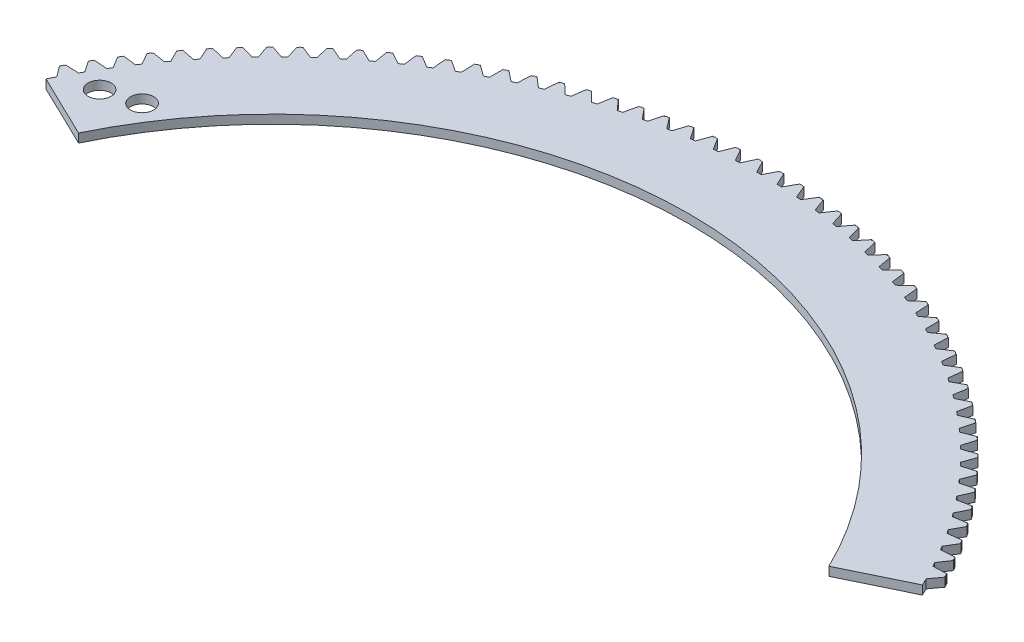
from build123d import *

# Parameters (mm, degrees)
SALIENTE_EXTRUIR1_DEPTH = 2.5
CROQUIS2_R              = 3.3
CORTAR_EXTRUIR1_DEPTH   = 2.5


# Read off the part's stored shape, not the designer's step: Saliente-Extruir1
with BuildPart() as part:
    # Saliente-Extruir1 outline → Saliente-Extruir1 (new body)
    with BuildSketch(Plane(origin=(0, 0, 0), x_dir=(1, 0, 0), z_dir=(0, 1, 0))):
        with BuildLine():
            Line((231.241720971, 10.756587138), (233.558294646, 13.910122691))
            Line((233.558294646, 13.910122691), (233.321502185, 13.98383382))
            ThreePointArc((233.321502185, 13.98383382), (233.28120566, 14.441592034), (232.928863632, 14.736586081))
            Line((232.928863632, 14.736586081), (233.002072992, 14.973534155))
            Line((233.002072992, 14.973534155), (229.092934922, 14.847916675))
            ThreePointArc((229.092934922, 14.847916675), (228.778691711, 15.41962652), (228.461768711, 15.989855207))
            Line((228.461768711, 15.989855207), (230.641815453, 19.2392427))
            Line((230.641815453, 19.2392427), (230.402096473, 19.302794338))
            ThreePointArc((230.402096473, 19.302794338), (230.342326111, 19.75841907), (229.9777311, 20.038127616))
            Line((229.9777311, 20.038127616), (230.040774792, 20.277980682))
            Line((230.040774792, 20.277980682), (226.140564472, 19.985864653))
            ThreePointArc((226.140564472, 19.985864653), (225.802234397, 20.543669629), (225.461290021, 21.099880526))
            Line((225.461290021, 21.099880526), (227.500850106, 24.439214589))
            Line((227.500850106, 24.439214589), (227.258640281, 24.492491234))
            ThreePointArc((227.258640281, 24.492491234), (227.17950471, 24.945154413), (226.803319347, 25.209069106))
            Line((226.803319347, 25.209069106), (226.856082792, 25.451391244))
            Line((226.856082792, 25.451391244), (222.971886977, 24.993309217))
            ThreePointArc((222.971886977, 24.993309217), (222.610084609, 25.536194527), (222.245738189, 26.077375734))
            Line((222.245738189, 26.077375734), (224.141107116, 29.500587723))
            Line((224.141107116, 29.500587723), (223.896846649, 29.543492548))
            ThreePointArc((223.896846649, 29.543492548), (223.798489693, 29.992371487), (223.411397671, 30.240012677))
            Line((223.411397671, 30.240012677), (223.453784976, 30.484363483))
            Line((223.453784976, 30.484363483), (219.592661225, 29.861149435))
            ThreePointArc((219.592661225, 29.861149435), (219.208043899, 30.388127406), (218.820957401, 30.913294344))
            Line((218.820957401, 30.913294344), (220.568692615, 34.414163365))
            Line((220.568692615, 34.414163365), (220.322825433, 34.446618393))
            ThreePointArc((220.322825433, 34.446618393), (220.205425851, 34.890897281), (219.808130686, 35.121814895))
            Line((219.808130686, 35.121814895), (219.840064814, 35.367750276))
            Line((219.840064814, 35.367750276), (216.009028683, 34.580538091))
            ThreePointArc((216.009028683, 34.580538091), (215.602295299, 35.090649975), (215.193172121, 35.598847186))
            Line((215.193172121, 35.598847186), (216.790099247, 39.171011388))
            Line((216.790099247, 39.171011388), (216.5430722, 39.192957634))
            ThreePointArc((216.5430722, 39.192957634), (216.406843358, 39.631829022), (216.00006711, 39.845603382))
            Line((216.00006711, 39.845603382), (216.021490023, 40.092676365))
            Line((216.021490023, 40.092676365), (212.227502332, 39.142897764))
            ThreePointArc((212.227502332, 39.142897764), (211.799392086, 39.63521549), (211.368975776, 40.125518384))
            Line((211.368975776, 40.125518384), (212.812194378, 43.762486511))
            Line((212.812194378, 43.762486511), (212.564456421, 43.773884089))
            ThreePointArc((212.564456421, 43.773884089), (212.409645907, 44.206550355), (211.994127867, 44.402792938))
            Line((211.994127867, 44.402792938), (212.00500063, 44.650554483))
            Line((212.00500063, 44.650554483), (208.254954832, 43.539936421))
            ThreePointArc((208.254954832, 43.539936421), (207.806245869, 44.013564291), (207.355318773, 44.485080831))
            Line((207.355318773, 44.485080831), (208.642207607, 48.180244006))
            Line((208.642207607, 48.180244006), (208.39420899, 48.181072202))
            ThreePointArc((208.39420899, 48.181072202), (208.221098162, 48.606747), (207.79759351, 48.785101149))
            Line((207.79759351, 48.785101149), (207.797896361, 49.033100964))
            Line((207.797896361, 49.033100964), (204.098606032, 47.763662489))
            ThreePointArc((204.098606032, 47.763662489), (203.630114028, 48.217738812), (203.159495862, 48.669611146))
            Line((203.159495862, 48.669611146), (204.287717633, 52.416254868))
            Line((204.287717633, 52.416254868), (204.039909078, 52.406512176))
            ThreePointArc((204.039909078, 52.406512176), (203.848812554, 52.824421869), (203.418090983, 52.984563434))
            Line((203.418090983, 52.984563434), (203.407823374, 53.232350795))
            Line((203.407823374, 53.232350795), (199.766009846, 51.806399377))
            ThreePointArc((199.766009846, 51.806399377), (199.278586525, 52.240098045), (198.789132884, 52.671504073))
            Line((198.789132884, 52.671504073), (199.756638476, 56.462820403))
            Line((199.756638476, 56.462820403), (199.50947036, 56.44252453))
            ThreePointArc((199.50947036, 56.44252453), (199.300735447, 56.851909592), (198.863579768, 56.993547527))
            Line((198.863579768, 56.993547527), (198.842760358, 57.240672095))
            Line((198.842760358, 57.240672095), (195.265040529, 55.660799433))
            ThreePointArc((195.265040529, 55.660799433), (194.759572106, 56.073331429), (194.252172902, 56.483486305))
            Line((194.252172902, 56.483486305), (195.057205098, 60.312586224))
            Line((195.057205098, 60.312586224), (194.811126634, 60.281774058))
            ThreePointArc((194.811126634, 60.281774058), (194.585132695, 60.681890456), (194.142337411, 60.804767342))
            Line((194.142337411, 60.804767342), (194.111004039, 61.050779984))
            Line((194.111004039, 61.050779984), (190.603878359, 59.3198573))
            ThreePointArc((190.603878359, 59.3198573), (190.081283927, 59.710472139), (189.55686177, 60.098629702))
            Line((189.55686177, 60.098629702), (190.197958433, 63.958555616))
            Line((190.197958433, 63.958555616), (189.953416854, 63.917283155))
            ThreePointArc((189.953416854, 63.917283155), (189.710574619, 64.307403703), (189.262944484, 64.411296219))
            Line((189.262944484, 64.411296219), (189.221154097, 64.65574982))
            Line((189.221154097, 64.65574982), (185.790994777, 62.776922647))
            ThreePointArc((185.790994777, 62.776922647), (185.252224631, 63.144909747), (184.711733143, 63.510363885))
            Line((184.711733143, 63.510363885), (185.187729868, 67.394102252))
            Line((185.187729868, 67.394102252), (184.945169613, 67.342444505))
            ThreePointArc((184.945169613, 67.342444505), (184.685920434, 67.721860182), (184.234268988, 67.806579509))
            Line((184.234268988, 67.806579509), (184.182097536, 68.049029792))
            Line((184.182097536, 68.049029792), (180.835136985, 66.025712256))
            ThreePointArc((180.835136985, 66.025712256), (180.281170888, 66.370402237), (179.725592965, 66.712488179))
            Line((179.725592965, 66.712488179), (180.035625189, 70.612982232))
            Line((180.035625189, 70.612982232), (179.795487097, 70.551033086))
            ThreePointArc((179.795487097, 70.551033086), (179.520302142, 70.919054326), (179.065450235, 70.984446493))
            Line((179.065450235, 70.984446493), (179.002992537, 71.224452818))
            Line((179.002992537, 71.224452818), (175.745312048, 69.060321447))
            ThreePointArc((175.745312048, 69.060321447), (175.177157442, 69.381087351), (174.607503463, 69.699182878))
            Line((174.607503463, 69.699182878), (174.751008032, 73.609345439))
            Line((174.751008032, 73.609345439), (174.513728539, 73.537217481))
            ThreePointArc((174.513728539, 73.537217481), (174.223107942, 73.89317543), (173.76588224, 73.939121589))
            Line((173.76588224, 73.939121589), (173.693251809, 74.176247759))
            Line((173.693251809, 74.176247759), (170.530770528, 71.875234809))
            ThreePointArc((170.530770528, 71.875234809), (169.9494607, 72.171493245), (169.366766678, 72.465019826))
            Line((169.366766678, 72.465019826), (169.34348287, 76.377746164))
            Line((169.34348287, 76.377746164), (169.109493217, 76.295570484))
            ThreePointArc((169.109493217, 76.295570484), (168.803965162, 76.638818208), (168.345196644, 76.665234856))
            Line((168.345196644, 76.665234856), (168.262525481, 76.899049908))
            Line((168.262525481, 76.899049908), (165.200989666, 74.465336225))
            ThreePointArc((165.200989666, 74.465336225), (164.607581858, 74.736548435), (164.012907555, 75.004972283))
            Line((164.012907555, 75.004972283), (163.82287755, 78.913153007))
            Line((163.82287755, 78.913153007), (163.592603, 78.821078953))
            ThreePointArc((163.592603, 78.821078953), (163.272722766, 79.150992621), (162.813245216, 79.157831747))
            Line((162.813245216, 79.157831747), (162.720683571, 79.387910738))
            Line((162.720683571, 79.387910738), (159.765656159, 76.82591817))
            ThreePointArc((159.765656159, 76.82591817), (159.161229642, 77.071591011), (158.555656633, 77.314424059))
            Line((158.555656633, 77.314424059), (158.199225438, 81.21095802))
            Line((158.199225438, 81.21095802), (157.9730845, 81.109152931))
            ThreePointArc((157.9730845, 81.109152931), (157.63943345, 81.425132945), (157.18008194, 81.412382119))
            Line((157.18008194, 81.412382119), (157.07779804, 81.638306894))
            Line((157.07779804, 81.638306894), (154.234648555, 78.952690272))
            ThreePointArc((154.234648555, 78.952690272), (153.620302657, 79.172377115), (153.004932353, 79.389177902))
            Line((153.004932353, 79.389177902), (152.48274718, 83.266985082))
            Line((152.48274718, 83.266985082), (152.261150852, 83.155633983))
            ThreePointArc((152.261150852, 83.155633983), (151.914335376, 83.457106069), (151.455944751, 83.424788465))
            Line((151.455944751, 83.424788465), (151.344124488, 83.646148418))
            Line((151.344124488, 83.646148418), (148.618019294, 80.841787107))
            ThreePointArc((148.618019294, 80.841787107), (147.994871393, 81.035088651), (147.370823037, 81.225463131))
            Line((147.370823037, 81.225463131), (146.683832128, 85.077497489))
            Line((146.683832128, 85.077497489), (146.467183147, 84.956802754))
            ThreePointArc((146.467183147, 84.956802754), (146.107833561, 85.243219003), (145.651236918, 85.191393356))
            Line((145.651236918, 85.191393356), (145.53008352, 85.40778618))
            Line((145.53008352, 85.40778618), (142.925976442, 82.489775226))
            ThreePointArc((142.925976442, 82.489775226), (142.29515993, 82.656340227), (141.663568549, 82.819942483))
            Line((141.663568549, 82.819942483), (140.813019458, 86.639204743))
            Line((140.813019458, 86.639204743), (140.601711571, 86.509385727))
            ThreePointArc((140.601711571, 86.509385727), (140.230480972, 86.780225597), (139.776508146, 86.708986097))
            Line((139.776508146, 86.708986097), (139.646241802, 86.920018511))
            Line((139.646241802, 86.920018511), (137.168865135, 83.893659398))
            ThreePointArc((137.168865135, 83.893659398), (136.531527347, 84.033185307), (135.893541681, 84.169718182))
            Line((135.893541681, 84.169718182), (134.880979016, 87.949268538))
            Line((134.880979016, 87.949268538), (134.675396262, 87.810561179))
            ThreePointArc((134.675396262, 87.810561179), (134.292959339, 88.065332434), (133.842435399, 87.974808555))
            Line((133.842435399, 87.974808555), (133.70329286, 88.18009702))
            Line((133.70329286, 88.18009702), (131.357148774, 85.050888051))
            ThreePointArc((131.357148774, 85.050888051), (130.714448893, 85.163121563), (130.071229302, 85.272337201))
            Line((130.071229302, 85.272337201), (128.898491924, 89.005307911))
            Line((128.898491924, 89.005307911), (128.699007938, 88.857964302))
            ThreePointArc((128.699007938, 88.857964302), (128.306059746, 89.09620391), (127.859803492, 88.986560174))
            Line((127.859803492, 88.986560174), (127.712037641, 89.185731591))
            Line((127.712037641, 89.185731591), (125.501390012, 85.959357913))
            ThreePointArc((125.501390012, 85.959357913), (124.854496956, 86.04409543), (124.207213298, 86.125795724))
            Line((124.207213298, 86.125795724), (122.876430991, 89.805403576))
            Line((122.876430991, 89.805403576), (122.683408322, 89.649691504))
            ThreePointArc((122.683408322, 89.649691504), (122.280663021, 89.87096648), (121.839485497, 89.742402157))
            Line((121.839485497, 89.742402157), (121.683364889, 89.935094544))
            Line((121.683364889, 89.935094544), (119.61223155, 86.617417836))
            ThreePointArc((119.61223155, 86.617417836), (118.962321838, 86.674505831), (118.312151336, 86.728542782))
            Line((118.312151336, 86.728542782), (116.825740946, 90.348101406))
            Line((116.825740946, 90.348101406), (116.639530401, 90.184303869))
            ThreePointArc((116.639530401, 90.184303869), (116.227719956, 90.388212059), (115.792422975, 90.240960807))
            Line((115.792422975, 90.240960807), (115.628231351, 90.426823957))
            Line((115.628231351, 90.426823957), (113.700376796, 87.023871791))
            ThreePointArc((113.700376796, 87.023871791), (113.048632398, 87.05320709), (112.396757493, 87.079483076))
            Line((112.396757493, 87.079483076), (110.757418551, 90.632415082))
            Line((110.757418551, 90.632415082), (110.578358557, 90.460829772))
            ThreePointArc((110.578358557, 90.460829772), (110.158231408, 90.647000585), (109.729606096, 90.481330024))
            Line((109.729606096, 90.481330024), (109.557641864, 90.660026143))
            Line((109.557641864, 90.660026143), (107.776570409, 87.177981051))
            ThreePointArc((107.776570409, 87.177981051), (107.124176596, 87.179511014), (106.471782788, 87.177978961))
            Line((106.471782788, 87.177978961), (104.682492614, 90.657827881))
            Line((104.682492614, 90.657827881), (104.510908601, 90.478766644))
            ThreePointArc((104.510908601, 90.478766644), (104.083228304, 90.646861725), (103.662053662, 90.463072952))
            Line((103.662053662, 90.463072952), (103.482629355, 90.634277269))
            Line((103.482629355, 90.634277269), (101.851578772, 87.079465527))
            ThreePointArc((101.851578772, 87.079465527), (101.199721948, 87.05318814), (100.547995635, 87.023851608))
            Line((100.547995635, 87.023851608), (98.612003943, 90.424293616))
            Line((98.612003943, 90.424293616), (98.448207755, 90.238081884))
            ThreePointArc((98.448207755, 90.238081884), (98.013751593, 90.387795732), (97.600793079, 90.186222771))
            Line((97.600793079, 90.186222771), (97.414234792, 90.349624134))
            Line((97.414234792, 90.349624134), (95.936170422, 86.72850428))
            ThreePointArc((95.936170422, 86.72850428), (95.286035963, 86.674468156), (94.636162274, 86.617381326))
            Line((94.636162274, 86.617381326), (92.556985283, 89.932236722))
            Line((92.556985283, 89.932236722), (92.40127461, 89.739212924))
            ThreePointArc((92.40127461, 89.739212924), (91.960832181, 89.870273442), (91.556840323, 89.651282641))
            Line((91.556840323, 89.651282641), (91.363487113, 89.806584077))
            Line((91.363487113, 89.806584077), (90.041096475, 86.125735193))
            ThreePointArc((90.041096475, 86.125735193), (89.393866565, 86.044039481), (88.747027203, 85.959307049))
            Line((88.747027203, 85.959307049), (86.528441263, 89.182551482))
            Line((86.528441263, 89.182551482), (86.381099099, 88.983066428))
            ThreePointArc((86.381099099, 88.983066428), (85.93547088, 89.095235422), (85.541179909, 88.859224782))
            Line((85.541179909, 88.859224782), (85.341383184, 89.006144041))
            Line((85.341383184, 89.006144041), (84.177071088, 85.272253815))
            ThreePointArc((84.177071088, 85.272253815), (83.533922567, 85.163048012), (82.891293651, 85.050824997))
            Line((82.891293651, 85.050824997), (80.537328396, 88.176600404))
            Line((80.537328396, 88.176600404), (80.398622527, 87.971016645))
            ThreePointArc((80.398622527, 87.971016645), (79.94861842, 88.064090255), (79.564744935, 87.811488711))
            Line((79.564744935, 87.811488711), (79.358867813, 87.949758776))
            Line((79.358867813, 87.949758776), (78.354751985, 84.169611368))
            ThreePointArc((78.354751985, 84.169611368), (77.716854199, 84.033095038), (77.079604123, 83.893586496))
            Line((77.079604123, 83.893586496), (74.594535166, 86.916211742))
            Line((74.594535166, 86.916211742), (74.464717681, 86.704902915))
            ThreePointArc((74.464717681, 86.704902915), (74.011155542, 86.778711985), (73.63839721, 86.509978626))
            Line((73.63839721, 86.509978626), (73.42681386, 86.639348198))
            Line((73.42681386, 86.639348198), (72.584721081, 82.819811926))
            ThreePointArc((72.584721081, 82.819811926), (71.953233757, 82.656234337), (71.322521057, 82.489694975))
            Line((71.322521057, 82.489694975), (68.710862238, 85.403676178))
            Line((68.710862238, 85.403676178), (68.590169073, 85.187026322))
            ThreePointArc((68.590169073, 85.187026322), (68.133873223, 85.241436709), (67.772907509, 84.957059941))
            Line((67.772907509, 84.957059941), (67.556002472, 85.0772939))
            Line((67.556002472, 85.0772939), (66.877465256, 81.225308774))
            ThreePointArc((66.877465256, 81.225308774), (66.253536383, 81.034968433), (65.630507631, 80.841702145))
            Line((65.630507631, 80.841702145), (62.897002831, 83.641742651))
            Line((62.897002831, 83.641742651), (62.785653338, 83.420145516))
            ThreePointArc((62.785653338, 83.420145516), (62.327453067, 83.455058331), (61.978936005, 83.155554992))
            Line((61.978936005, 83.155554992), (61.757103493, 83.26643482))
            Line((61.757103493, 83.26643482), (61.243357289, 79.388999945))
            ThreePointArc((61.243357289, 79.388999945), (60.62812103, 79.172244052), (60.01390874, 78.952603357))
            Line((60.01390874, 78.952603357), (57.163523282, 81.63361337))
            Line((57.163523282, 81.63361337), (57.061719831, 81.407471695))
            ThreePointArc((57.061719831, 81.407471695), (56.602447891, 81.422823486), (56.26701289, 81.108737905))
            Line((56.26701289, 81.108737905), (56.040656068, 81.210062085))
            Line((56.040656068, 81.210062085), (55.692637004, 77.314222959))
            ThreePointArc((55.692637004, 77.314222959), (55.08721163, 77.071446764), (54.482932201, 76.825832157))
            Line((54.482932201, 76.825832157), (51.52084384, 79.382937988))
            Line((51.52084384, 79.382937988), (51.428771454, 79.15266277))
            ThreePointArc((51.428771454, 79.15266277), (50.969262543, 79.148425638), (50.647519235, 78.820328646))
            Line((50.647519235, 78.820328646), (50.417049495, 78.911913027))
            Line((50.417049495, 78.911913027), (50.235392664, 75.004748748))
            ThreePointArc((50.235392664, 75.004748748), (49.64087852, 74.736394829), (49.0476302, 74.465254046))
            Line((49.0476302, 74.465254046), (45.979219734, 76.893806969))
            Line((45.979219734, 76.893806969), (45.897045749, 76.659816721))
            ThreePointArc((45.897045749, 76.659816721), (45.438134997, 76.635998366), (45.130668131, 76.294486259))
            Line((45.130668131, 76.294486259), (44.896504337, 76.376164392))
            Line((44.896504337, 76.376164392), (44.88154263, 72.464774806))
            ThreePointArc((44.88154263, 72.464774806), (44.299020128, 72.171332254), (43.717881017, 71.875159449))
            Line((43.717881017, 71.875159449), (40.54872253, 74.17074416))
            Line((40.54872253, 74.17074416), (40.476596291, 73.933464144))
            ThreePointArc((40.476596291, 73.933464144), (40.01911774, 73.890107854), (39.726486119, 73.535801311))
            Line((39.726486119, 73.535801311), (39.489053849, 73.60742475))
            Line((39.489053849, 73.60742475), (39.640817335, 69.698917562))
            ThreePointArc((39.640817335, 69.698917562), (39.071344994, 69.380921081), (38.503371082, 69.06025592))
            Line((38.503371082, 69.06025592), (35.239221825, 71.21869856))
            Line((35.239221825, 71.21869856), (35.177274418, 70.97856002))
            ThreePointArc((35.177274418, 70.97856002), (34.722059508, 70.915744592), (34.444794971, 70.549287542))
            Line((34.444794971, 70.549287542), (34.204525744, 70.610726118))
            Line((34.204525744, 70.610726118), (34.5227416, 66.712203981))
            ThreePointArc((34.5227416, 66.712203981), (33.967354116, 66.370232912), (33.413577365, 66.025659583))
            Line((33.413577365, 66.025659583), (30.060367315, 68.043035335))
            Line((30.060367315, 68.043035335), (30.008711326, 67.800474706))
            ThreePointArc((30.008711326, 67.800474706), (29.556587382, 67.718314304), (29.295193842, 67.340372761))
            Line((29.295193842, 67.340372761), (29.052524332, 67.391514812))
            Line((29.052524332, 67.391514812), (29.53661732, 63.510062432))
            ThreePointArc((29.53661732, 63.510062432), (28.996323689, 63.144739689), (28.457750154, 62.776885831))
            Line((28.457750154, 62.776885831), (25.021571254, 64.649526058))
            Line((25.021571254, 64.649526058), (24.980300564, 64.40498418))
            ThreePointArc((24.980300564, 64.40498418), (24.532089294, 64.303628126), (24.287041817, 63.914888976))
            Line((24.287041817, 63.914888976), (24.042413062, 63.955641553))
            Line((24.042413062, 63.955641553), (24.69150656, 60.09831282))
            ThreePointArc((24.69150656, 60.09831282), (24.167288243, 59.71030375), (23.644896244, 59.319839305))
            Line((23.644896244, 59.319839305), (20.131991348, 61.044338227))
            Line((20.131991348, 61.044338227), (20.101180964, 60.79825954))
            ThreePointArc((20.101180964, 60.79825954), (19.657696964, 60.677892042), (19.429440909, 60.279061795))
            Line((19.429440909, 60.279061795), (19.183297508, 60.309350834))
            Line((19.183297508, 60.309350834), (19.996215084, 56.483156006))
            ThreePointArc((19.996215084, 56.483156006), (19.489024223, 56.073167169), (18.983762572, 55.660803156))
            Line((18.983762572, 55.660803156), (15.40051411, 57.234024053))
            Line((15.40051411, 57.234024053), (15.380220029, 56.98685579))
            ThreePointArc((15.380220029, 56.98685579), (14.942269305, 56.847695608), (14.731219514, 56.439499113))
            Line((14.731219514, 56.439499113), (14.484008816, 56.459269566))
            Line((14.484008816, 56.459269566), (15.459276348, 52.671162536))
            ThreePointArc((15.459276348, 52.671162536), (14.97003404, 52.239940415), (14.482820314, 51.806427626))
            Line((14.482820314, 51.806427626), (10.835738715, 53.225508549))
            Line((10.835738715, 53.225508549), (10.825997819, 52.977699923))
            ThreePointArc((10.825997819, 52.977699923), (10.39437632, 52.819999973), (10.200916362, 52.403179103))
            Line((10.200916362, 52.403179103), (9.953087658, 52.412395038))
            Line((9.953087658, 52.412395038), (11.088935996, 48.669260699))
            ThreePointArc((11.088935996, 48.669260699), (10.618530619, 48.217590333), (10.150249496, 47.763717962))
            Line((10.150249496, 47.763717962), (6.445961364, 49.026076949))
            Line((6.445961364, 49.026076949), (6.446791357, 48.778078338))
            ThreePointArc((6.446791357, 48.778078338), (6.022283528, 48.602125229), (5.846765006, 48.177437531))
            Line((5.846765006, 48.177437531), (5.59876871, 48.176082198))
            Line((5.59876871, 48.176082198), (6.893136868, 44.484723931))
            ThreePointArc((6.893136868, 44.484723931), (6.44242247, 44.013427481), (5.993924127, 43.540021684))
            Line((5.993924127, 43.540021684), (2.239160211, 44.643361465))
            Line((2.239160211, 44.643361465), (2.250559584, 44.395623591))
            ThreePointArc((2.250559584, 44.395623591), (1.833936943, 44.201737108), (1.676678851, 43.769954425))
            Line((1.676678851, 43.769954425), (1.42896568, 43.758030288))
            Line((1.42896568, 43.758030288), (2.879504567, 40.1251576))
            ThreePointArc((2.879504567, 40.1251576), (2.44929932, 39.635092846), (2.021397889, 39.143015226))
            Line((2.021397889, 39.143015226), (-1.777019139, 40.085327417))
            Line((-1.777019139, 40.085327417), (-1.755071104, 39.838300528))
            ThreePointArc((-1.755071104, 39.838300528), (-2.16305137, 39.626833048), (-2.301763225, 39.18874012))
            Line((-2.301763225, 39.18874012), (-2.548743067, 39.166268849))
            Line((-2.548743067, 39.166268849), (-0.944666399, 35.598485174))
            ThreePointArc((-0.944666399, 35.598485174), (-1.353581684, 35.090543949), (-1.760109589, 34.580689988))
            Line((-1.760109589, 34.580689988), (-5.595277524, 35.360258754))
            Line((-5.595277524, 35.360258754), (-5.562820714, 35.114391807))
            ThreePointArc((-5.562820714, 35.114391807), (-5.961417127, 34.885727659), (-6.081330645, 34.442120693))
            Line((-6.081330645, 34.442120693), (-6.327128286, 34.409143129))
            Line((-6.327128286, 34.409143129), (-4.572425876, 30.912933825))
            ThreePointArc((-4.572425876, 30.912933825), (-4.959309162, 30.388040387), (-5.343725854, 29.86133781))
            Line((-5.343725854, 29.86133781), (-9.208675489, 30.476743002))
            Line((-9.208675489, 30.476743002), (-9.165768895, 30.232482846))
            ThreePointArc((-9.165768895, 30.232482846), (-9.554257029, 29.987037613), (-9.655154275, 29.538722837))
            Line((-9.655154275, 29.538722837), (-9.899322993, 29.495298916))
            Line((-9.899322993, 29.495298916), (-7.997180694, 26.077019473))
            ThreePointArc((-7.997180694, 26.077019473), (-8.361330061, 25.53612882), (-8.722938112, 24.993535899))
            Line((-8.722938112, 24.993535899), (-12.610645905, 25.443655655))
            Line((-12.610645905, 25.443655655), (-12.557367506, 25.201446216))
            ThreePointArc((-12.557367506, 25.201446216), (-12.935041308, 24.939665981), (-13.016738906, 24.48745818))
            Line((-13.016738906, 24.48745818), (-13.25883494, 24.433666821))
            Line((-13.25883494, 24.433666821), (-11.212706651, 21.099531308))
            ThreePointArc((-11.212706651, 21.099531308), (-11.553461564, 20.543627434), (-11.891605067, 19.986131245))
            Line((-11.891605067, 19.986131245), (-15.795005897, 20.270144043))
            Line((-15.795005897, 20.270144043), (-15.731452522, 20.030425523))
            ThreePointArc((-15.731452522, 20.030425523), (-16.097625593, 19.752786054), (-16.159975064, 19.297507089))
            Line((-16.159975064, 19.297507089), (-16.399558419, 19.233446055))
            Line((-16.399558419, 19.233446055), (-14.213159822, 15.989515814))
            ThreePointArc((-14.213159822, 15.989515814), (-14.529902328, 15.419609915), (-14.843968083, 14.848224536))
            Line((-14.843968083, 14.848224536), (-18.755968083, 14.965610709))
            Line((-18.755968083, 14.965610709), (-18.682255238, 14.728818782))
            ThreePointArc((-18.682255238, 14.728818782), (-19.03626208, 14.435824673), (-19.079150107, 13.978301985))
            Line((-19.079150107, 13.978301985), (-19.315785354, 13.904087703))
            Line((-19.315785354, 13.904087703), (-16.993087181, 10.756260326))
            ThreePointArc((-16.993087181, 10.756260326), (-17.502796495, 9.734868807), (-18.004100719, 8.70932588))
            Line((-18.004100719, 8.70932588), (0, 0))
            ThreePointArc((0, 0), (107.124399281, 67.179511014), (214.248798561, 0))
            Line((214.248798561, 0), (232.252899281, 8.70932588))
            ThreePointArc((232.252899281, 8.70932588), (231.751514016, 9.735032884), (231.241720971, 10.756587138))
        make_face()
    extrude(amount=SALIENTE_EXTRUIR1_DEPTH)

    # Croquis2 → Cortar-Extruir1 (cut)
    with BuildSketch(Plane(origin=(0, 0, 0), x_dir=(-1, 0, 0), z_dir=(0, -1, 0))):
        with Locations(Location((7.72648116, 13.728674716, 0), (0, 0, 90))):
            Circle(CROQUIS2_R)
        with Locations(Location((-1.72785449, 16.402460571, 0), (0, 0, 90))):
            Circle(CROQUIS2_R)
    extrude(amount=-CORTAR_EXTRUIR1_DEPTH, mode=Mode.SUBTRACT)


solid = part.part
